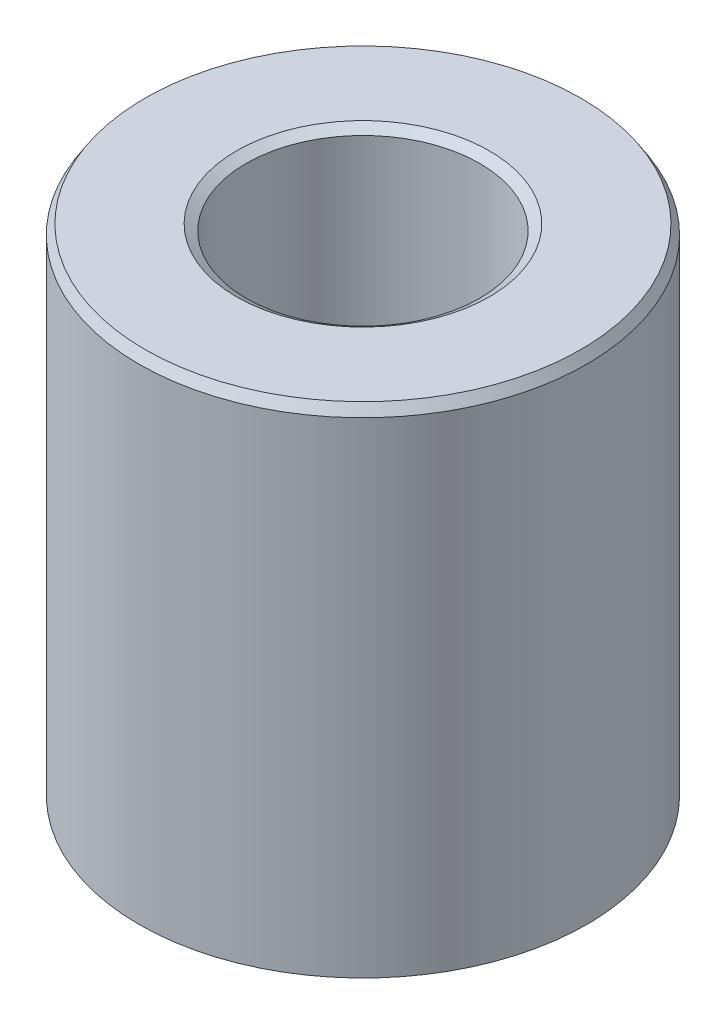
from build123d import *
from OCP.BRepFilletAPI import BRepFilletAPI_MakeChamfer

# Parameters (mm, degrees)
SKETCH1_R           = 50
BOSS_EXTRUDE1_DEPTH = 111.864383192
SKETCH2_R           = 26.089759754
CUT_EXTRUDE1_DEPTH  = 133.339110723
CHAMFER1_SIZE       = 2.153350376
CHAMFER1_SIZE2      = 1.355387407


with BuildPart() as part:
    # Sketch1 → Boss-Extrude1 (new body)
    with BuildSketch(Plane(origin=(0, 0, 0), x_dir=(1, 0, 0), z_dir=(0, 1, 0))):
        Circle(SKETCH1_R)
    extrude(amount=BOSS_EXTRUDE1_DEPTH)

    # Sketch2 → Cut-Extrude1 (cut, through all)
    with BuildSketch(Plane(origin=(0, 0, 0), x_dir=(1, 0, 0), z_dir=(0, 1, 0))):
        Circle(SKETCH2_R)
    extrude(amount=CUT_EXTRUDE1_DEPTH, mode=Mode.SUBTRACT)

    # Chamfer1: one chamfer whose edges measure the first distance from different faces: ONE call of the kernel's chamfer builder (chamfer() names one face for all edges)
    chamfer1_edges_1 = [part.edges().sort_by_distance(p)[0] for p in [
        (-26.089759754, 111.864383192, 0),
    ]]
    chamfer1_side_1 = [part.faces().sort_by_distance(p)[0] for p in [
        (-48.585786438, 111.864383192, 0),
    ]]
    chamfer1_edges_2 = [part.edges().sort_by_distance(p)[0] for p in [
        (-26.089759754, 0, 0),
    ]]
    chamfer1_side_2 = [part.faces().sort_by_distance(p)[0] for p in [
        (-26.089759754, 55.932191596, 0),
    ]]
    chamfer1_edges_3 = [part.edges().sort_by_distance(p)[0] for p in [
        (-50, 0, 0),
    ]]
    chamfer1_side_3 = [part.faces().sort_by_distance(p)[0] for p in [
        (-48.585786438, 0, 0),
    ]]
    chamfer1_edges_4 = [part.edges().sort_by_distance(p)[0] for p in [
        (-50, 111.864383192, 0),
    ]]
    chamfer1_side_4 = [part.faces().sort_by_distance(p)[0] for p in [
        (-50, 55.932191596, 0),
    ]]
    chamfer1 = BRepFilletAPI_MakeChamfer(part.part.solid().wrapped)
    for e in chamfer1_edges_1:
        chamfer1.Add(CHAMFER1_SIZE, CHAMFER1_SIZE2, e.wrapped, chamfer1_side_1[0].wrapped)  # the first distance lies on this face
    for e in chamfer1_edges_2:
        chamfer1.Add(CHAMFER1_SIZE, CHAMFER1_SIZE2, e.wrapped, chamfer1_side_2[0].wrapped)  # the first distance lies on this face
    for e in chamfer1_edges_3:
        chamfer1.Add(CHAMFER1_SIZE, CHAMFER1_SIZE2, e.wrapped, chamfer1_side_3[0].wrapped)  # the first distance lies on this face
    for e in chamfer1_edges_4:
        chamfer1.Add(CHAMFER1_SIZE, CHAMFER1_SIZE2, e.wrapped, chamfer1_side_4[0].wrapped)  # the first distance lies on this face
    add(Compound.cast(chamfer1.Shape()), mode=Mode.REPLACE)


solid = part.part
